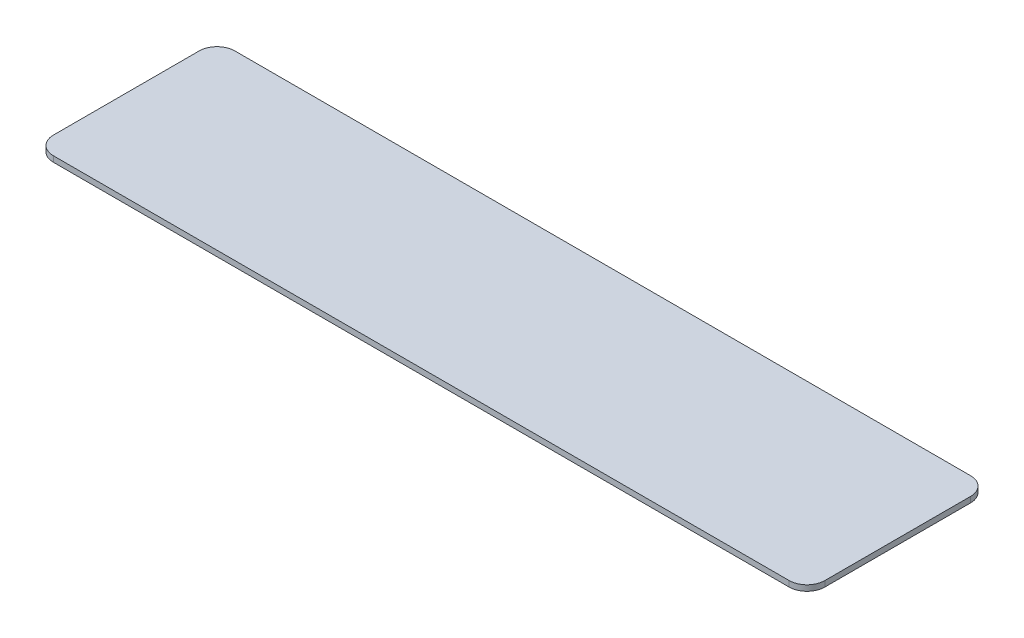
from build123d import *

# Parameters (mm, degrees)
SKETCH1_W           = 431.8
SKETCH1_H           = 101.6
BOSS_EXTRUDE1_DEPTH = 3.175
FILLET1_R           = 10


with BuildPart() as part:
    # Sketch1 → Boss-Extrude1 (new body)
    with BuildSketch(Plane(origin=(0, 0, 0), x_dir=(1, 0, 0), z_dir=(0, 1, 0))):
        with Locations((213.767466267, 50.8)):
            Rectangle(SKETCH1_W, SKETCH1_H)
    extrude(amount=BOSS_EXTRUDE1_DEPTH)

    # Fillet1
    fillet1_edges = [part.edges().sort_by_distance(p)[0] for p in [
        (429.667466267, 1.5875, -101.6),
        (429.667466267, 1.5875, 0),
        (-2.132533733, 1.5875, 0),
        (-2.132533733, 1.5875, -101.6),
    ]]
    fillet(fillet1_edges, radius=FILLET1_R)


solid = part.part
